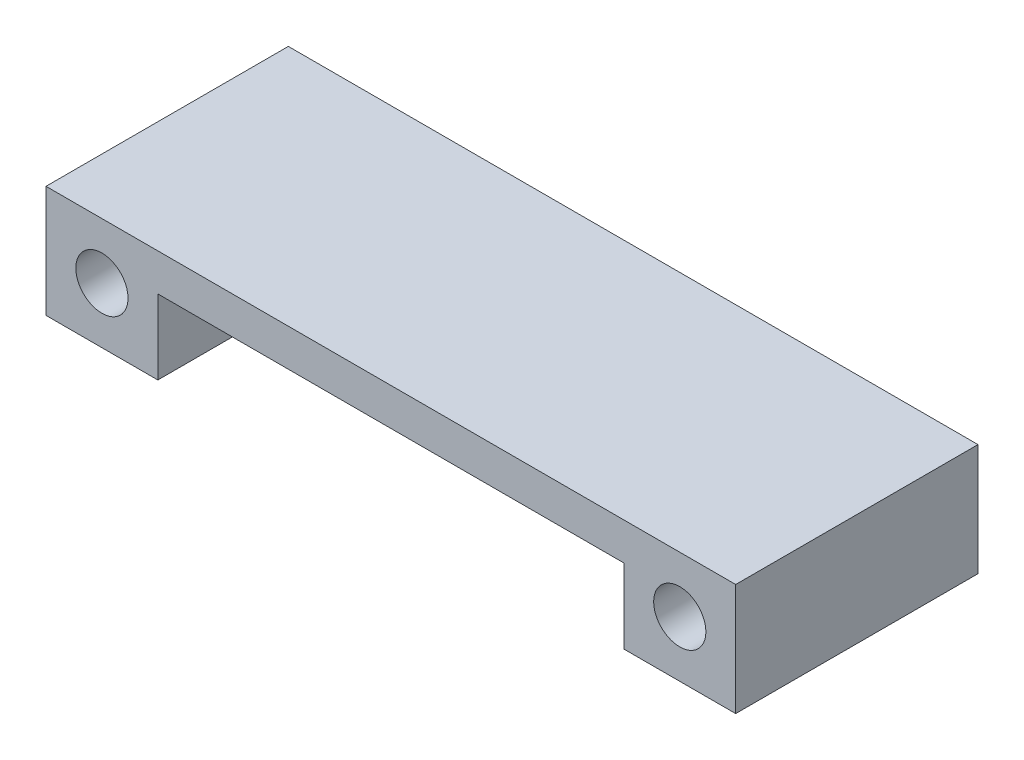
from build123d import *

# Parameters (mm, degrees)
SKETCH1_R           = 1.4
BOSS_EXTRUDE1_DEPTH = 13


with BuildPart() as part:
    # Sketch1 → Boss-Extrude1 (new body)
    with BuildSketch(Plane.XY):
        Polygon((-12.5, -4), (-12.5, 0), (12.5, 0), (12.5, -4), (18.5, -4), (18.5, 2), (-18.5, 2), (-18.5, -4), align=None)
        with Locations((-15.5, -1)):
            Circle(SKETCH1_R, mode=Mode.SUBTRACT)
        with Locations((15.5, -1)):
            Circle(SKETCH1_R, mode=Mode.SUBTRACT)
    extrude(amount=BOSS_EXTRUDE1_DEPTH)


solid = part.part
